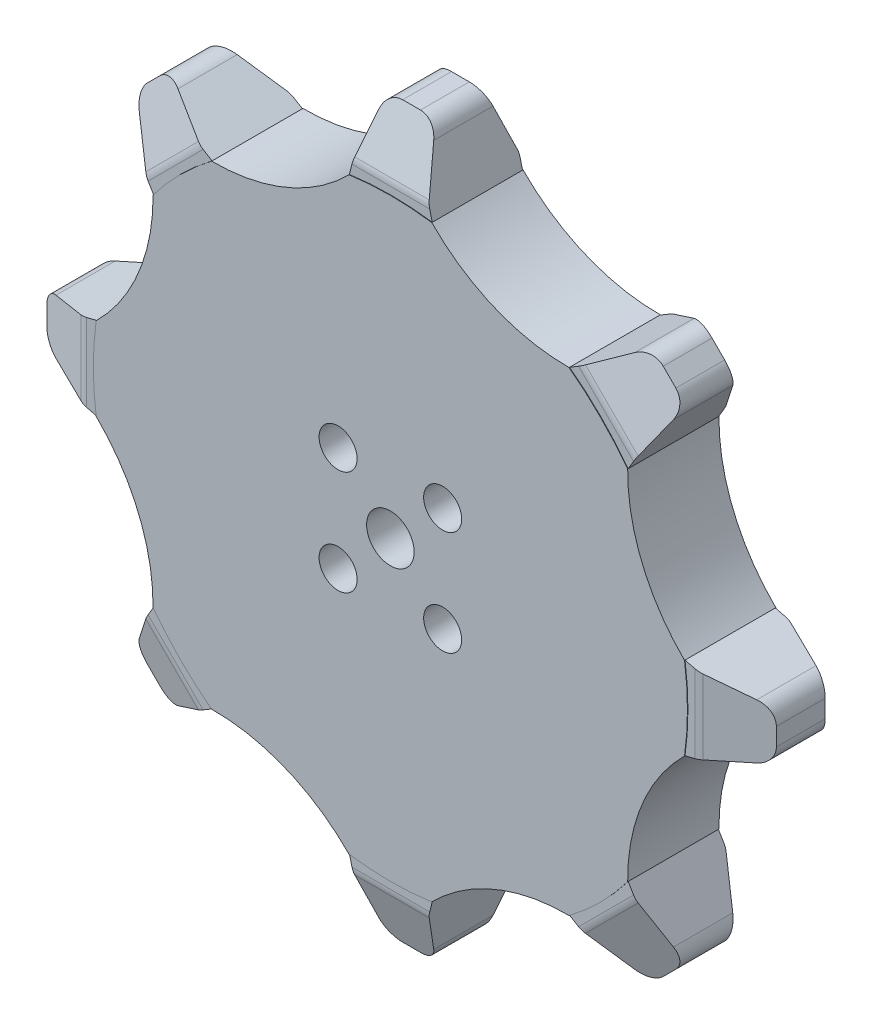
from build123d import *

# Parameters (mm, degrees)
SKETCH1_R           = 31.25
BOSS_EXTRUDE1_DEPTH = 15
BOSS_EXTRUDE2_DEPTH = 4.75
CHAMFER1_SIZE       = 6
CHAMFER1_SIZE2      = 2.183821406
CHAMFER2_SIZE       = 6
CHAMFER2_SIZE2      = 2.183821406
FILLET11_R          = 2
FILLET12_R          = 2
CIRPATTERN1_COUNT   = 8
SKETCH3_R           = 2.5
SKETCH3_R_2         = 2
CUT_EXTRUDE6_DEPTH  = 63.006740911
SKETCH14_W          = 114.781544729
SKETCH14_H          = 99.982125168
CUT_EXTRUDE11_DEPTH = 20
SKETCH15_W          = 194.409122682
SKETCH15_H          = 129.478767366
CUT_EXTRUDE12_DEPTH = 20
CUT_EXTRUDE13_DEPTH = 20
CIRPATTERN3_COUNT   = 8


with BuildPart() as part:
    # Sketch1 → Boss-Extrude1 (new, symmetric)
    with BuildSketch(Plane.XY):
        Circle(SKETCH1_R)
    extrude(amount=BOSS_EXTRUDE1_DEPTH, both=True)

    # Sketch2 → Boss-Extrude2 (add, symmetric)
    with BuildSketch(Plane.XY):
        Polygon((-28.372098708, -5), (-28.372098708, 5), (-38.372098708, 2.5), (-38.372098708, -2.5), align=None)
    extrude(amount=BOSS_EXTRUDE2_DEPTH, both=True)

    # Chamfer1
    chamfer1_edges = [part.edges().sort_by_distance(p)[0] for p in [
        (-38.372098708, 0, -4.75),
    ]]
    chamfer1_side = [part.faces().sort_by_distance(p)[0] for p in [
        (-34.440800156, 0, -4.75),
    ]]
    chamfer(chamfer1_edges, length=CHAMFER1_SIZE, length2=CHAMFER1_SIZE2, reference=chamfer1_side[0])

    # Chamfer2
    chamfer2_edges = [part.edges().sort_by_distance(p)[0] for p in [
        (-38.372098708, 0, 4.75),
    ]]
    chamfer2_side = [part.faces().sort_by_distance(p)[0] for p in [
        (-34.440800156, 0, 4.75),
    ]]
    chamfer(chamfer2_edges, length=CHAMFER2_SIZE, length2=CHAMFER2_SIZE2, reference=chamfer2_side[0])

    # Fillet11
    fillet11_edges = [part.edges().sort_by_distance(p)[0] for p in [
        (-38.372098708, -2.5, 0),
        (-38.372098708, 2.5, 0),
    ]]
    fillet(fillet11_edges, radius=FILLET11_R)

    # Fillet12
    fillet12_edges = [part.edges().sort_by_distance(p)[0] for p in [
        (-32.372098708, 0, 4.75),
        (-32.372098708, 0, -4.75),
    ]]
    fillet(fillet12_edges, radius=FILLET12_R)

    # CirPattern1: part ×8 about axis
    cirpattern1_axis = Axis((0, 0, 15), (0, 0, -1))


with BuildPart() as part_1:
    add(part.part)
    for i in range(1, CIRPATTERN1_COUNT):
        add(part.part.rotate(cirpattern1_axis, i * 360 / CIRPATTERN1_COUNT))

    # Sketch3 → Cut-Extrude6 (cut, through all)
    with BuildSketch(Plane.XY.offset(15)):
        Circle(SKETCH3_R)
        with Locations((5.5, 5.5)):
            Circle(SKETCH3_R_2)
        with Locations((-5.5, 5.5)):
            Circle(SKETCH3_R_2)
        with Locations((-5.5, -5.5)):
            Circle(SKETCH3_R_2)
        with Locations((5.5, -5.5)):
            Circle(SKETCH3_R_2)
    extrude(amount=-CUT_EXTRUDE6_DEPTH, mode=Mode.SUBTRACT)

    # Sketch14 → Cut-Extrude11 (cut)
    with BuildSketch(Plane(origin=(0, 0, -4.8), x_dir=(-1, 0, 0), z_dir=(0, 0, -1))):
        with Locations((10.903993862, -9.833989058)):
            Rectangle(SKETCH14_W, SKETCH14_H)
    extrude(amount=CUT_EXTRUDE11_DEPTH, mode=Mode.SUBTRACT)

    # Sketch15 → Cut-Extrude12 (cut)
    with BuildSketch(Plane.XY.offset(4.8)):
        with Locations((1.322307029, -4.255701029)):
            Rectangle(SKETCH15_W, SKETCH15_H)
    extrude(amount=CUT_EXTRUDE12_DEPTH, mode=Mode.SUBTRACT)

    # Sketch17 → Cut-Extrude13 (cut)
    with BuildSketch(Plane.XY.offset(4.8)):
        with BuildLine():
            Line((-3.917153419, 32.703485033), (-4.356824963, 30.944798856))
            ThreePointArc((-4.356824963, 30.944798856), (-10.969884461, 26.483643844), (-18.800536638, 24.962017589))
            Line((-18.800536638, 24.962017589), (-20.35501029, 25.89470178))
            Line((-20.35501029, 25.89470178), (-3.917153419, 32.703485033))
        make_face()
    cut_extrude13 = extrude(amount=-CUT_EXTRUDE13_DEPTH, mode=Mode.SUBTRACT)

    # CirPattern3: Cut-Extrude13 ×8 about axis
    cirpattern3_axis = Axis((0, 0, 15), (0, 0, -1))
    for i in range(1, CIRPATTERN3_COUNT):
        add(cut_extrude13.rotate(cirpattern3_axis, i * 360 / CIRPATTERN3_COUNT), mode=Mode.SUBTRACT)


solid = part_1.part
